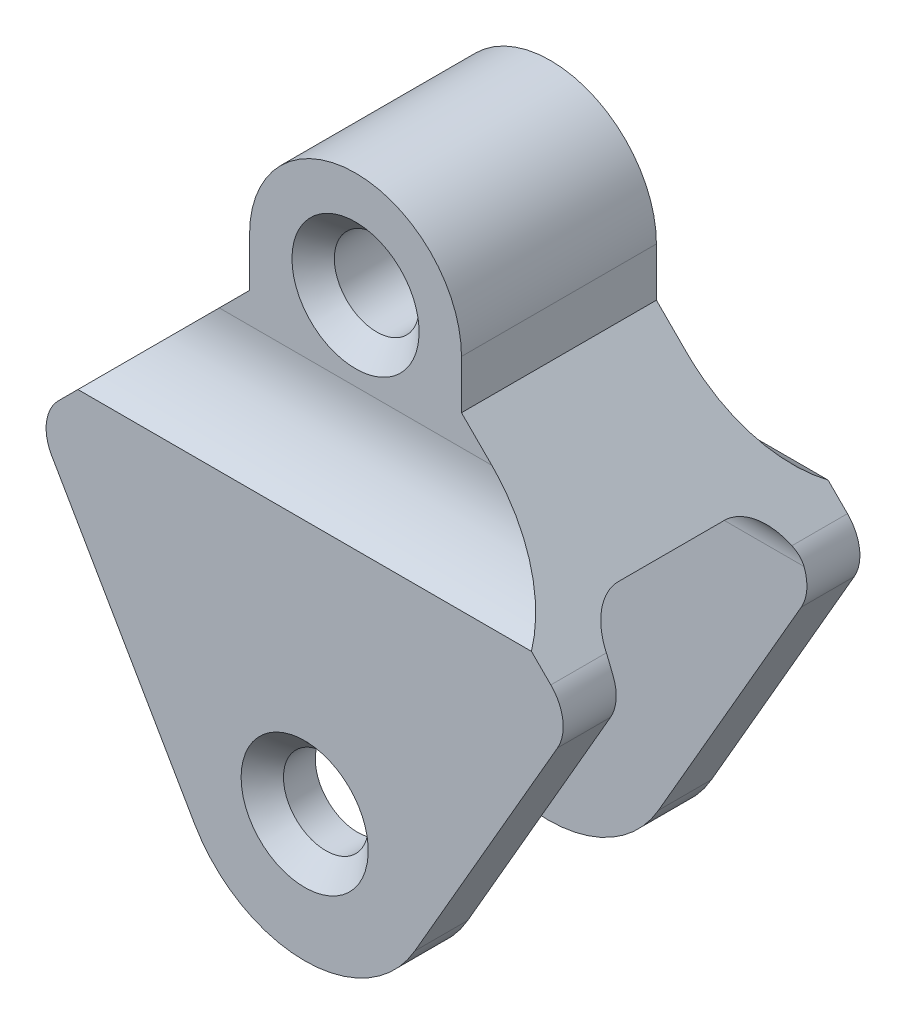
from build123d import *

# Parameters (mm, degrees)
SKETCH3_R           = 10
BOSS_EXTRUDE4_DEPTH = 35
FILLET3_R           = 10
CUT_EXTRUDE1_DEPTH  = 12
CUT_EXTRUDE2_DEPTH  = 22.5
FILLET4_R           = 25
FILLET5_R           = 10
CHAMFER2_SIZE       = 5
CHAMFER4_SIZE       = 5


with BuildPart() as part:
    # Sketch3 → Boss-Extrude4 (new body)
    with BuildSketch(Plane.XY):
        with BuildLine():
            Line((-25, 0), (-25, -11.491470389))
            Line((-25, -11.491470389), (-63.508529611, -50))
            Line((-63.508529611, -50), (-25.980762114, -115))
            ThreePointArc((-25.980762114, -115), (0, -130), (25.980762114, -115))
            Line((25.980762114, -115), (63.508529611, -50))
            Line((63.508529611, -50), (25, -11.491470389))
            Line((25, -11.491470389), (25, 0))
            ThreePointArc((25, 0), (0, 25), (-25, 0))
        make_face()
        Circle(SKETCH3_R, mode=Mode.SUBTRACT)
        with Locations((0, -100)):
            Circle(SKETCH3_R, mode=Mode.SUBTRACT)
    extrude(amount=BOSS_EXTRUDE4_DEPTH)

    # Fillet3
    fillet3_edges = [part.edges().sort_by_distance(p)[0] for p in [
        (-63.508529611, -50, 17.5),
        (63.508529611, -50, 17.5),
    ]]
    fillet(fillet3_edges, radius=FILLET3_R)

    # Sketch5 → Cut-Extrude1 (cut)
    with BuildSketch(Plane(origin=(0, 0, 0), x_dir=(-1, 0, 0), z_dir=(0, 0, -1))):
        with BuildLine():
            Line((-53.508529611, -40), (53.508529611, -40))
            Line((53.508529611, -40), (25, -11.491470389))
            Line((25, -11.491470389), (25, 0))
            ThreePointArc((25, 0), (0, 25), (-25, 0))
            Line((-25, 0), (-25, -11.491470389))
            Line((-25, -11.491470389), (-53.508529611, -40))
        make_face()
    extrude(amount=-CUT_EXTRUDE1_DEPTH, mode=Mode.SUBTRACT)

    # Sketch6 → Cut-Extrude2 (cut)
    with BuildSketch(Plane.XY.offset(35)):
        with BuildLine():
            Line((-51.508529611, -38), (51.508529611, -38))
            Line((51.508529611, -38), (58.082708445, -44.574178834))
            ThreePointArc((58.082708445, -44.574178834), (60.926089247, -50.339984724), (59.671894671, -56.645246646))
            Line((59.671894671, -56.645246646), (25.980762114, -115))
            ThreePointArc((25.980762114, -115), (0, -130), (-25.980762114, -115))
            Line((-25.980762114, -115), (-59.671894671, -56.645246646))
            ThreePointArc((-59.671894671, -56.645246646), (-60.926089247, -50.339984724), (-58.082708445, -44.574178834))
            Line((-58.082708445, -44.574178834), (-51.508529611, -38))
        make_face()
    extrude(amount=-CUT_EXTRUDE2_DEPTH, mode=Mode.SUBTRACT)

    # Fillet4
    # the kernel refuses this fillet: 25 mm, written as the material it adds along each edge
    with BuildSketch(Plane(origin=(106.893920871, -40, 12), x_dir=(0, 1, 0), z_dir=(-1, 0, 0))) as fillet4_piece_1_section:
        with BuildLine():
            CenterArc((21.354156504, 25), FILLET4_R, 211.332251498, 58.667748502)
            Line((0, 12), (-0.42708313, 11.74))
            ThreePointArc((-0.42708313, 11.74), (-0.5, 6), (-0.5, 0))
            Line((-0.5, 0), (0, -0.5))
            Line((0, -0.5), (21.354156504, -0.5))
            Line((21.354156504, -0.5), (21.354156504, 0))
        make_face()
    fillet4_piece_1 = extrude(amount=213.787841742, mode=Mode.PRIVATE)
    fillet4_piece_1 = split(fillet4_piece_1, bisect_by=Plane(origin=(-24.314247143, -10.805717532, 8.724953467), z_dir=(0.7071067811865464, -0.7071067811865487, 0)), keep=Keep.TOP, mode=Mode.PRIVATE)
    fillet4_piece_1 = split(fillet4_piece_1, bisect_by=Plane(origin=(24.314247143, -10.805717532, 8.724953467), z_dir=(-0.7071067811865461, -0.7071067811865489, 0)), keep=Keep.TOP, mode=Mode.PRIVATE)
    add(fillet4_piece_1)

    # Fillet5
    fillet5_edges = [part.edges().sort_by_distance(p)[0] for p in [
        (0, -38, 12.5),
    ]]
    fillet(fillet5_edges, radius=FILLET5_R)

    # Chamfer2
    chamfer2_edges = [part.edges().sort_by_distance(p)[0] for p in [
        (-10, 0, 12),
    ]]
    chamfer(chamfer2_edges, length=CHAMFER2_SIZE)

    # Mirror2: part across plane


with BuildPart() as part_1:
    add(part.part)
    add(part.part.mirror(Plane(origin=(0, -100, 35), x_dir=(1, 0, 0), z_dir=(0, 0, 1))))

    # Chamfer4
    chamfer4_edges = [part_1.edges().sort_by_distance(p)[0] for p in [
        (-10, -100, 70),
        (-10, -100, 0),
    ]]
    chamfer(chamfer4_edges, length=CHAMFER4_SIZE)


solid = part_1.part
